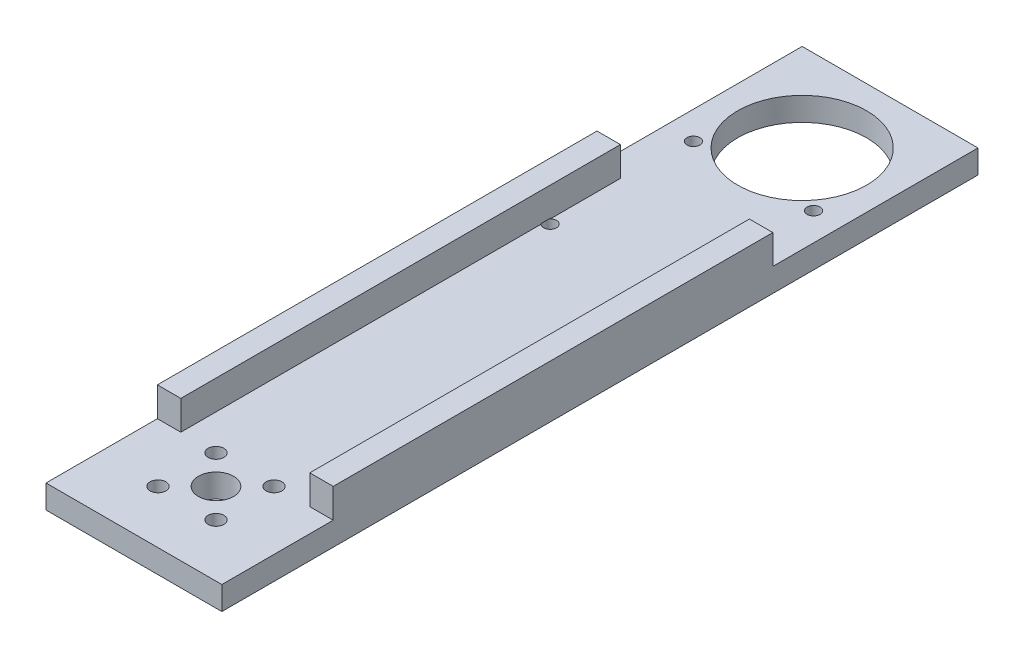
from build123d import *

# Parameters (mm, degrees)
S_BOX1_W      = 30
S_BOX1_H      = 4
BOSS_1_DEPTH  = 129
S_BOX2_W      = 4
S_BOX2_H      = 5.5
BOSS_2_DEPTH  = 75
S_BOX3_W      = 4
S_BOX3_H      = 5.5
BOSS_3_DEPTH  = 75
S_HOLE4_R     = 3
HOLE_4_DEPTH  = 4.2
S_HOLE5_R     = 1.35
HOLE_5_DEPTH  = 4.2
S_HOLE6_R     = 1.35
HOLE_6_DEPTH  = 4.2
S_HOLE7_R     = 1.35
HOLE_7_DEPTH  = 4.2
S_HOLE8_R     = 1.35
HOLE_8_DEPTH  = 4.2
S_HOLE9_R     = 11
HOLE_9_DEPTH  = 4.2
S_HOLE10_R    = 1.1
HOLE_10_DEPTH = 4.2
S_HOLE11_R    = 1.1
HOLE_11_DEPTH = 4.2
S_HOLE12_R    = 1.1
HOLE_12_DEPTH = 4.2
S_HOLE13_R    = 1.1
HOLE_13_DEPTH = 4.2


with BuildPart() as part:
    # S_box1 → Boss_1 (new body)
    with BuildSketch(Plane.XY.offset(-115)):
        with Locations((0, 20.625)):
            Rectangle(S_BOX1_W, S_BOX1_H)
    extrude(amount=BOSS_1_DEPTH)

    # S_box2 → Boss_2 (add)
    with BuildSketch(Plane.XY.offset(-80)):
        with Locations((-13, 24.875)):
            Rectangle(S_BOX2_W, S_BOX2_H)
    extrude(amount=BOSS_2_DEPTH)

    # S_box3 → Boss_3 (add)
    with BuildSketch(Plane.XY.offset(-80)):
        with Locations((13, 24.875)):
            Rectangle(S_BOX3_W, S_BOX3_H)
    extrude(amount=BOSS_3_DEPTH)

    # S_hole4 → Hole_4 (cut)
    with BuildSketch(Plane(origin=(0, 18.525, 0), x_dir=(1, 0, 0), z_dir=(0, 1, 0))):
        Circle(S_HOLE4_R)
    extrude(amount=HOLE_4_DEPTH, mode=Mode.SUBTRACT)

    # S_hole5 → Hole_5 (cut)
    with BuildSketch(Plane(origin=(0, 18.525, 0), x_dir=(1, 0, 0), z_dir=(0, 1, 0))):
        with Locations((4.949747468, -4.949747468)):
            Circle(S_HOLE5_R)
    extrude(amount=HOLE_5_DEPTH, mode=Mode.SUBTRACT)

    # S_hole6 → Hole_6 (cut)
    with BuildSketch(Plane(origin=(0, 18.525, 0), x_dir=(1, 0, 0), z_dir=(0, 1, 0))):
        with Locations((-4.949747468, -4.949747468)):
            Circle(S_HOLE6_R)
    extrude(amount=HOLE_6_DEPTH, mode=Mode.SUBTRACT)

    # S_hole7 → Hole_7 (cut)
    with BuildSketch(Plane(origin=(0, 18.525, 0), x_dir=(1, 0, 0), z_dir=(0, 1, 0))):
        with Locations((-4.949747468, 4.949747468)):
            Circle(S_HOLE7_R)
    extrude(amount=HOLE_7_DEPTH, mode=Mode.SUBTRACT)

    # S_hole8 → Hole_8 (cut)
    with BuildSketch(Plane(origin=(0, 18.525, 0), x_dir=(1, 0, 0), z_dir=(0, 1, 0))):
        with Locations((4.949747468, 4.949747468)):
            Circle(S_HOLE8_R)
    extrude(amount=HOLE_8_DEPTH, mode=Mode.SUBTRACT)

    # S_hole9 → Hole_9 (cut)
    with BuildSketch(Plane(origin=(0, 18.525, 0), x_dir=(1, 0, 0), z_dir=(0, 1, 0))):
        with Locations((0, 100)):
            Circle(S_HOLE9_R)
    extrude(amount=HOLE_9_DEPTH, mode=Mode.SUBTRACT)

    # S_hole10 → Hole_10 (cut)
    with BuildSketch(Plane(origin=(0, 18.525, 0), x_dir=(1, 0, 0), z_dir=(0, 1, 0))):
        with Locations((-10.25, 91.7)):
            Circle(S_HOLE10_R)
    extrude(amount=HOLE_10_DEPTH, mode=Mode.SUBTRACT)

    # S_hole11 → Hole_11 (cut)
    with BuildSketch(Plane(origin=(0, 18.525, 0), x_dir=(1, 0, 0), z_dir=(0, 1, 0))):
        with Locations((10.25, 91.7)):
            Circle(S_HOLE11_R)
    extrude(amount=HOLE_11_DEPTH, mode=Mode.SUBTRACT)

    # S_hole12 → Hole_12 (cut)
    with BuildSketch(Plane(origin=(0, 18.525, 0), x_dir=(1, 0, 0), z_dir=(0, 1, 0))):
        with Locations((-10.25, 67.25)):
            Circle(S_HOLE12_R)
    extrude(amount=HOLE_12_DEPTH, mode=Mode.SUBTRACT)

    # S_hole13 → Hole_13 (cut)
    with BuildSketch(Plane(origin=(0, 18.525, 0), x_dir=(1, 0, 0), z_dir=(0, 1, 0))):
        with Locations((10.25, 67.25)):
            Circle(S_HOLE13_R)
    extrude(amount=HOLE_13_DEPTH, mode=Mode.SUBTRACT)


solid = part.part
